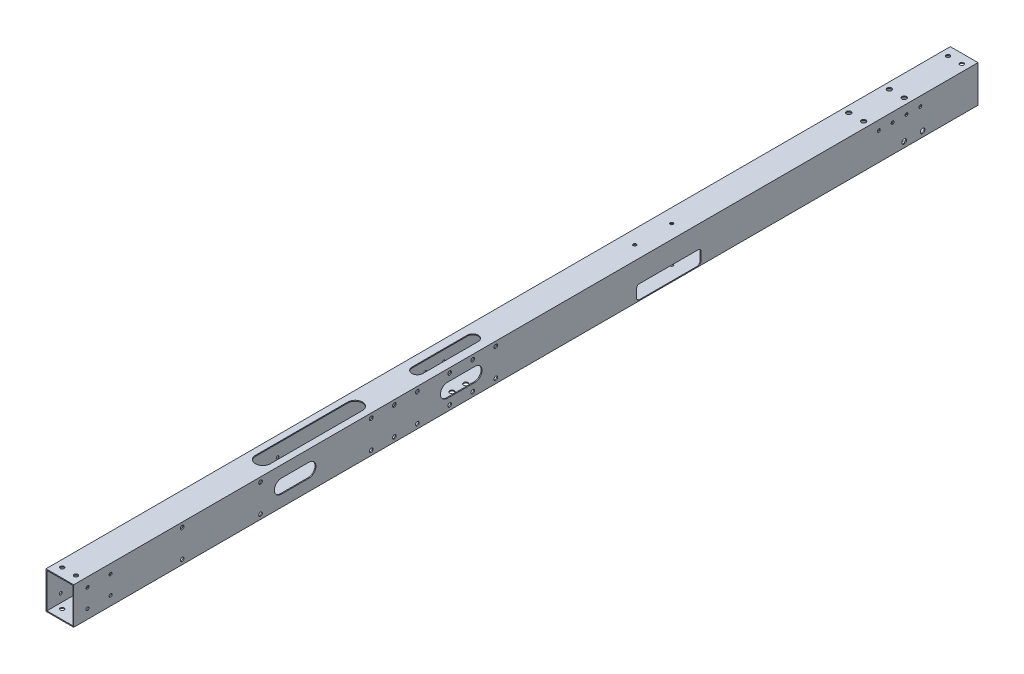
from build123d import *

# Parameters (mm, degrees)
SKETCH_1_W             = 30
SKETCH_1_H             = 40
SKETCH_1_W_2           = 28
SKETCH_1_H_2           = 38
EXTRUDE_1_DEPTH        = 940
SKETCH_5_R             = 2.5
CUT_EXTRUDE_3_DEPTH    = 941.97024395
CUT_EXTRUDE_4_DEPTH    = 1
SKETCH_7_R             = 1.5
CUT_EXTRUDE_5_DEPTH    = 1
SKETCH_17_W            = 30
SKETCH_17_H            = 40
SKETCH_17_W_2          = 28
SKETCH_17_H_2          = 38
EXTRUDE_2_DEPTH        = 20
SKETCH_18_W            = 30
SKETCH_18_H            = 40
SKETCH_18_W_2          = 28
SKETCH_18_H_2          = 38
EXTRUDE_3_DEPTH        = 20
SKETCH_19_R            = 2.1
CUT_EXTRUDE_16_DEPTH   = 961.950050731
SKETCH_20_R            = 1.6
CUT_EXTRUDE_17_DEPTH   = 961.67684473
SKETCH_21_R            = 2.5
SKETCH_21_R_2          = 1.6
CUT_EXTRUDE_18_DEPTH   = 961.67684473
SKETCH_23_R            = 2.5
CUT_EXTRUDE_19_DEPTH   = 961.950050731
SKETCH_24_R            = 4.5
CUT_EXTRUDE_20_DEPTH   = 10
SKETCH_26_R            = 2
CUT_EXTRUDE_22_DEPTH   = 961.67684473
CUT_EXTRUDE_28_DEPTH   = 10
PATTERN_LINEAR_4_COUNT = 2
PATTERN_LINEAR_4_PITCH = 255
PATTERN_LINEAR_8_COUNT = 2
PATTERN_LINEAR_8_PITCH = 205
PATTERN_LINEAR_9_COUNT = 2
PATTERN_LINEAR_9_PITCH = 230
CUT_EXTRUDE_START      = -20
SKETCH_34_R            = 1.75
CUT_EXTRUDE_29_DEPTH   = 20
SKETCH_35_R            = 1.5
CUT_EXTRUDE_30_DEPTH   = 10
CUT_EXTRUDE_31_DEPTH   = 10
SKETCH_37_R            = 1.65
CUT_EXTRUDE_32_DEPTH   = 52
SKETCH_39_R            = 1.75
CUT_EXTRUDE_33_DEPTH   = 10
SKETCH_40_W            = 70
SKETCH_40_H            = 15
CUT_EXTRUDE_34_DEPTH   = 10
EXTRUDE_5_DEPTH        = 1
SKETCH_43_W            = 38.522995696
SKETCH_43_H            = 13.00002022
EXTRUDE_6_DEPTH        = 1
FILLET_1_R             = 3


with BuildPart() as part:
    # 草图1 → 凸台-拉伸1 (new body)
    with BuildSketch(Plane.XY):
        Rectangle(SKETCH_1_W, SKETCH_1_H)
        Rectangle(SKETCH_1_W_2, SKETCH_1_H_2, mode=Mode.SUBTRACT)
    extrude(amount=EXTRUDE_1_DEPTH)

    # 草图5 → 切除-拉伸3 (cut, through all)
    with BuildSketch(Plane.XZ.offset(20)):
        with Locations((-8, 53)):
            Circle(SKETCH_5_R)
        with Locations((8, 53)):
            Circle(SKETCH_5_R)
        with Locations((-8, 97)):
            Circle(SKETCH_5_R)
        with Locations((8, 97)):
            Circle(SKETCH_5_R)
    extrude(amount=-CUT_EXTRUDE_3_DEPTH, mode=Mode.SUBTRACT)

    # 草图6 → 切除-拉伸4 (cut)
    with BuildSketch(Plane(origin=(15, 0, 0), x_dir=(0, 0, -1), z_dir=(1, 0, 0))):
        with BuildLine():
            Line((-345, -7.5), (-375, -7.5))
            ThreePointArc((-375, -7.5), (-382.5, 0), (-375, 7.5))
            Line((-375, 7.5), (-345, 7.5))
            ThreePointArc((-345, 7.5), (-337.5, 0), (-345, -7.5))
        make_face()
        with BuildLine():
            Line((-525, -7.5), (-555, -7.5))
            ThreePointArc((-555, -7.5), (-562.5, 0), (-555, 7.5))
            Line((-555, 7.5), (-525, 7.5))
            ThreePointArc((-525, 7.5), (-517.5, 0), (-525, -7.5))
        make_face()
        with BuildLine():
            Line((-705, -7.5), (-735, -7.5))
            ThreePointArc((-735, -7.5), (-742.5, 0), (-735, 7.5))
            Line((-735, 7.5), (-705, 7.5))
            ThreePointArc((-705, 7.5), (-697.5, 0), (-705, -7.5))
        make_face()
    extrude(amount=-CUT_EXTRUDE_4_DEPTH, mode=Mode.SUBTRACT)

    # 草图7 → 切除-拉伸5 (cut)
    with BuildSketch(Plane.ZY.offset(15)):
        with Locations((350, 0)):
            Circle(SKETCH_7_R)
        with Locations((370, 0)):
            Circle(SKETCH_7_R)
        with Locations((530, 0)):
            Circle(SKETCH_7_R)
        with Locations((550, 0)):
            Circle(SKETCH_7_R)
        with Locations((710, 0)):
            Circle(SKETCH_7_R)
        with Locations((730, 0)):
            Circle(SKETCH_7_R)
    extrude(amount=-CUT_EXTRUDE_5_DEPTH, mode=Mode.SUBTRACT)

    # 草图17 → 凸台-拉伸2 (add)
    with BuildSketch(Plane.XY.offset(940)):
        Rectangle(SKETCH_17_W, SKETCH_17_H)
        Rectangle(SKETCH_17_W_2, SKETCH_17_H_2, mode=Mode.SUBTRACT)
    extrude(amount=EXTRUDE_2_DEPTH)

    # 草图18 → 凸台-拉伸3 (add)
    with BuildSketch(Plane(origin=(0, 0, 0), x_dir=(-1, 0, 0), z_dir=(0, 0, -1))):
        Rectangle(SKETCH_18_W, SKETCH_18_H)
        Rectangle(SKETCH_18_W_2, SKETCH_18_H_2, mode=Mode.SUBTRACT)
    extrude(amount=EXTRUDE_3_DEPTH)

    # 草图19 → 切除-拉伸16 (cut, through all)
    with BuildSketch(Plane(origin=(0, 20, 0), x_dir=(1, 0, 0), z_dir=(0, 1, 0))):
        with Locations((-7.5, -950)):
            Circle(SKETCH_19_R)
        with Locations((7.5, -950)):
            Circle(SKETCH_19_R)
        with Locations((-7.5, 10)):
            Circle(SKETCH_19_R)
        with Locations((7.5, 10)):
            Circle(SKETCH_19_R)
    extrude(amount=-CUT_EXTRUDE_16_DEPTH, mode=Mode.SUBTRACT)

    # 草图20 → 切除-拉伸17 (cut, through all)
    with BuildSketch(Plane(origin=(15, 0, 0), x_dir=(0, 0, -1), z_dir=(1, 0, 0))):
        with Locations((-945, 10)):
            Circle(SKETCH_20_R)
        with Locations((-920, 10)):
            Circle(SKETCH_20_R)
        with Locations((-920, -10)):
            Circle(SKETCH_20_R)
        with Locations((-945, -10)):
            Circle(SKETCH_20_R)
    extrude(amount=-CUT_EXTRUDE_17_DEPTH, mode=Mode.SUBTRACT)

    # 草图21 → 切除-拉伸18 (cut, through all)
    with BuildSketch(Plane(origin=(15, 0, 0), x_dir=(0, 0, -1), z_dir=(1, 0, 0))):
        with Locations((-40, -14)):
            Circle(SKETCH_21_R)
        with Locations((-60, -14)):
            Circle(SKETCH_21_R)
        with Locations((-42.5, 10)):
            Circle(SKETCH_21_R_2)
        with Locations((-57.5, 10)):
            Circle(SKETCH_21_R_2)
        with Locations((-72.5, 10)):
            Circle(SKETCH_21_R_2)
        with Locations((-87.5, 10)):
            Circle(SKETCH_21_R_2)
    extrude(amount=-CUT_EXTRUDE_18_DEPTH, mode=Mode.SUBTRACT)

    # 草图23 → 切除-拉伸19 (cut, through all)
    with BuildSketch(Plane(origin=(0, 20, 0), x_dir=(1, 0, 0), z_dir=(0, 1, 0))):
        with Locations((0, -520)):
            Circle(SKETCH_23_R)
        with Locations((0, -535)):
            Circle(SKETCH_23_R)
        with Locations((0, -550)):
            Circle(SKETCH_23_R)
        with Locations((0, -565)):
            Circle(SKETCH_23_R)
    extrude(amount=-CUT_EXTRUDE_19_DEPTH, mode=Mode.SUBTRACT)

    # 草图24 → 切除-拉伸20 (cut)
    with BuildSketch(Plane(origin=(0, 20, 0), x_dir=(1, 0, 0), z_dir=(0, 1, 0))):
        with Locations((0, -520)):
            Circle(SKETCH_24_R)
        with Locations((0, -535)):
            Circle(SKETCH_24_R)
        with Locations((0, -550)):
            Circle(SKETCH_24_R)
        with Locations((0, -565)):
            Circle(SKETCH_24_R)
    extrude(amount=-CUT_EXTRUDE_20_DEPTH, mode=Mode.SUBTRACT)

    # 草图26 → 切除-拉伸22 (cut, through all)
    with BuildSketch(Plane(origin=(15, 0, 0), x_dir=(0, 0, -1), z_dir=(1, 0, 0))):
        with Locations((-842.5, 15)):
            Circle(SKETCH_26_R)
        with Locations((-842.5, -15)):
            Circle(SKETCH_26_R)
        with Locations((-757.5, -15)):
            Circle(SKETCH_26_R)
        with Locations((-757.5, 15)):
            Circle(SKETCH_26_R)
    cut_extrude_22 = extrude(amount=-CUT_EXTRUDE_22_DEPTH, mode=Mode.SUBTRACT)

    # 草图33 → 切除-拉伸28 (cut)
    with BuildSketch(Plane(origin=(0, 20, 0), x_dir=(1, 0, 0), z_dir=(0, 1, 0))):
        with BuildLine():
            Line((6, -512.5), (6, -572.5))
            ThreePointArc((6, -572.5), (0, -578.5), (-6, -572.5))
            Line((-6, -572.5), (-6, -512.5))
            ThreePointArc((-6, -512.5), (0, -506.5), (6, -512.5))
        make_face()
    extrude(amount=-CUT_EXTRUDE_28_DEPTH, mode=Mode.SUBTRACT)

    # 阵列(线性)4: 切除-拉伸22 ×2
    with Locations(*[(0, 0, -i * PATTERN_LINEAR_4_PITCH) for i in range(1, PATTERN_LINEAR_4_COUNT)]):
        add(cut_extrude_22, mode=Mode.SUBTRACT)

    # 阵列(线性)8: 切除-拉伸22 ×2
    with Locations(*[(0, 0, -i * PATTERN_LINEAR_8_PITCH) for i in range(1, PATTERN_LINEAR_8_COUNT)]):
        add(cut_extrude_22, mode=Mode.SUBTRACT)

    # 阵列(线性)9: 切除-拉伸22 ×2
    with Locations(*[(0, 0, -i * PATTERN_LINEAR_9_PITCH) for i in range(1, PATTERN_LINEAR_9_COUNT)]):
        add(cut_extrude_22, mode=Mode.SUBTRACT)

    # 草图34 → 切除-拉伸29 (cut)
    with BuildSketch(Plane(origin=(15, 0, 0), x_dir=(0, 0, -1), z_dir=(1, 0, 0)).offset(CUT_EXTRUDE_START)):
        with Locations((-935, 0)):
            Circle(SKETCH_34_R)
        with Locations((-915, 0)):
            Circle(SKETCH_34_R)
    extrude(amount=-CUT_EXTRUDE_29_DEPTH, mode=Mode.SUBTRACT)

    # 草图35 → 切除-拉伸30 (cut)
    with BuildSketch(Plane.XZ.offset(20)):
        with Locations((5, 720)):
            Circle(SKETCH_35_R)
        with Locations((5, 700)):
            Circle(SKETCH_35_R)
        with Locations((5, 680)):
            Circle(SKETCH_35_R)
        with Locations((5, 660)):
            Circle(SKETCH_35_R)
        with Locations((5, 640)):
            Circle(SKETCH_35_R)
        with Locations((5, 740)):
            Circle(SKETCH_35_R)
    extrude(amount=-CUT_EXTRUDE_30_DEPTH, mode=Mode.SUBTRACT)

    # 草图36 → 切除-拉伸31 (cut)
    with BuildSketch(Plane(origin=(0, 20, 0), x_dir=(1, 0, 0), z_dir=(0, 1, 0))):
        with BuildLine():
            Line((8, -640), (8, -740))
            ThreePointArc((8, -740), (0, -748), (-8, -740))
            Line((-8, -740), (-8, -640))
            ThreePointArc((-8, -640), (0, -632), (8, -640))
        make_face()
    extrude(amount=-CUT_EXTRUDE_31_DEPTH, mode=Mode.SUBTRACT)

    # 草图37 → 切除-拉伸32 (cut)
    with BuildSketch(Plane(origin=(0, 20, 0), x_dir=(1, 0, 0), z_dir=(0, 1, 0))):
        with Locations((0, -297)):
            Circle(SKETCH_37_R)
        with Locations((0, -337)):
            Circle(SKETCH_37_R)
    extrude(amount=-CUT_EXTRUDE_32_DEPTH, mode=Mode.SUBTRACT)

    # 草图39 → 切除-拉伸33 (cut)
    with BuildSketch(Plane.XZ.offset(20)):
        with Locations((0, 117)):
            Circle(SKETCH_39_R)
        with Locations((0, 137)):
            Circle(SKETCH_39_R)
    extrude(amount=-CUT_EXTRUDE_33_DEPTH, mode=Mode.SUBTRACT)

    # 草图40 → 切除-拉伸34 (cut)
    with BuildSketch(Plane(origin=(15, 0, 0), x_dir=(0, 0, -1), z_dir=(1, 0, 0))):
        with Locations((-315, -11.5)):
            Rectangle(SKETCH_40_W, SKETCH_40_H)
    extrude(amount=-CUT_EXTRUDE_34_DEPTH, mode=Mode.SUBTRACT)

    # 草图42 → 凸台-拉伸5 (add)
    with BuildSketch(Plane(origin=(15, 0, 0), x_dir=(0, 0, -1), z_dir=(1, 0, 0))):
        Polygon((-350, -8.24794841), (-350, -4), (-334.23295051, -4), (-334.23295051, 12.222841732), (-383.610977641, 12.222841732), (-383.610977641, -8.24794841), align=None)
    extrude(amount=-EXTRUDE_5_DEPTH)

    # 草图43 → 凸台-拉伸6 (add)
    with BuildSketch(Plane.ZY.offset(15)):
        with Locations((362.400416305, 1.435266839)):
            Rectangle(SKETCH_43_W, SKETCH_43_H)
    extrude(amount=-EXTRUDE_6_DEPTH)

    # 圆角1
    fillet_1_edges = [part.edges().sort_by_distance(p)[0] for p in [
        (14.5, -19, 280),
        (14.5, -4, 280),
        (14.5, -19, 350),
        (14.5, -4, 350),
    ]]
    fillet(fillet_1_edges, radius=FILLET_1_R)


solid = part.part
